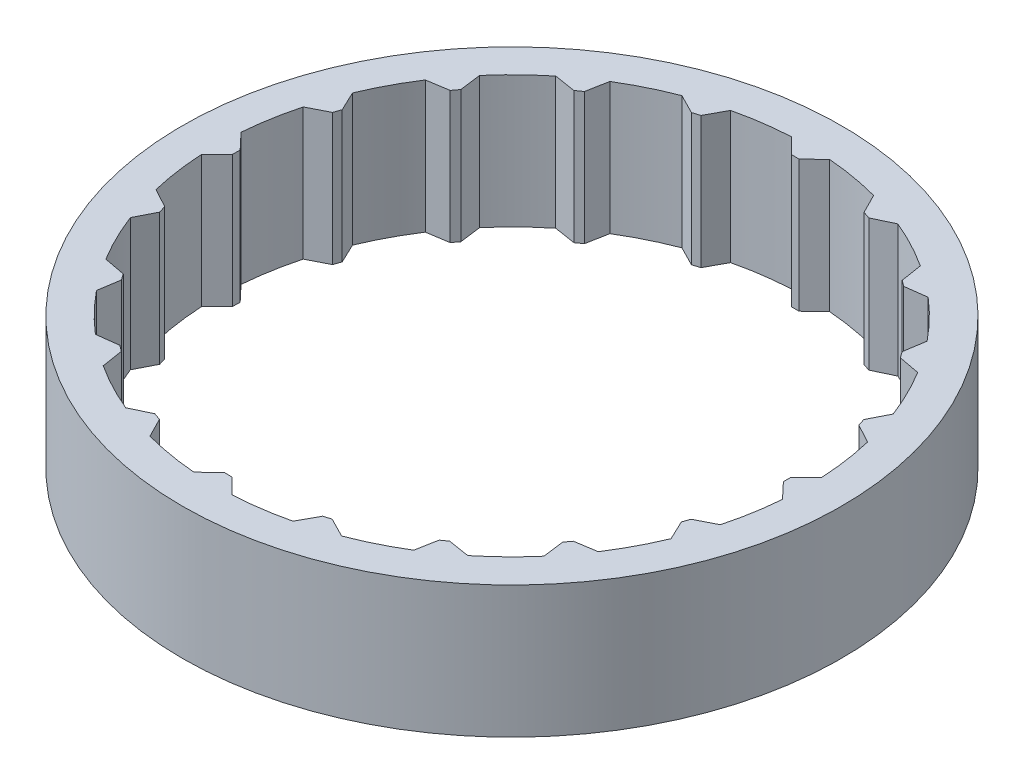
from build123d import *

# Parameters (mm, degrees)
SKETCH1_R           = 62.5
BOSS_EXTRUDE1_DEPTH = 25
CAVITY1_DEPTH       = 25
CUT_EXTRUDE1_DEPTH  = 25


# Read off the part's stored shape, not the designer's step: Cavity1
with BuildPart() as part:
    # Sketch1 → Boss-Extrude1 (new body)
    with BuildSketch(Plane(origin=(0, 0, 0), x_dir=(1, 0, 0), z_dir=(0, 1, 0))):
        with Locations(Location((0, 0, 0), (0, 0, 270))):
            Circle(SKETCH1_R)
    extrude(amount=BOSS_EXTRUDE1_DEPTH)

    # Cavity1 outline → Cavity1 (cut)
    with BuildSketch(Plane(origin=(0, 0, 0), x_dir=(1, 0, 0), z_dir=(0, 1, 0))):
        with BuildLine():
            Line((16.350867892, -49.873660473), (20.022970331, -51.745036944))
            ThreePointArc((20.022970331, -51.745036944), (24.456878574, -49.800038203), (28.704396647, -47.476000203))
            Line((28.704396647, -47.476000203), (29.464309883, -43.425207924))
            ThreePointArc((29.464309883, -43.425207924), (30.217762384, -42.903777412), (30.961999914, -42.369276757))
            Line((30.961999914, -42.369276757), (35.032663999, -43.014319485))
            ThreePointArc((35.032663999, -43.014319485), (38.648523661, -39.79436276), (41.969986165, -36.271516008))
            Line((41.969986165, -36.271516008), (41.440942946, -32.18415751))
            ThreePointArc((41.440942946, -32.18415751), (41.996387967, -31.455417996), (42.539030133, -30.717095621))
            Line((42.539030133, -30.717095621), (46.609790903, -30.07266333))
            ThreePointArc((46.609790903, -30.07266333), (49.053656447, -25.89294042), (51.12393549, -21.5161257))
            Line((51.12393549, -21.5161257), (49.357722251, -17.792300112))
            ThreePointArc((49.357722251, -17.792300112), (49.660788964, -16.927585698), (49.94871817, -16.05771374))
            Line((49.94871817, -16.05771374), (53.621101197, -14.186887953))
            ThreePointArc((53.621101197, -14.186887953), (54.653750036, -9.456539258), (55.270192281, -4.654189691))
            Line((55.270192281, -4.654189691), (52.43969828, -1.658411006))
            ThreePointArc((52.43969828, -1.658411006), (52.460720403, -0.742365963), (52.465752134, 0.173906448))
            Line((52.465752134, 0.173906448), (55.380278979, 3.087996269))
            ThreePointArc((55.380278979, 3.087996269), (54.900628251, 7.905931261), (54.002892036, 12.66372824))
            Line((54.002892036, 12.66372824), (50.385185747, 14.63821233))
            ThreePointArc((50.385185747, 14.63821233), (50.122105488, 15.515919131), (49.843747202, 16.388900869))
            Line((49.843747202, 16.388900869), (51.715123672, 20.061003308))
            ThreePointArc((51.715123672, 20.061003308), (49.770124931, 24.49491155), (47.446086932, 28.742429624))
            Line((47.446086932, 28.742429624), (43.395294653, 29.50234286))
            ThreePointArc((43.395294653, 29.50234286), (42.87386414, 30.255795361), (42.339363485, 31.000032891))
            Line((42.339363485, 31.000032891), (42.984406214, 35.070696976))
            ThreePointArc((42.984406214, 35.070696976), (39.764449489, 38.686556638), (36.241602736, 42.008019142))
            Line((36.241602736, 42.008019142), (32.154244239, 41.478975923))
            ThreePointArc((32.154244239, 41.478975923), (31.425504725, 42.034420944), (30.68718235, 42.57706311))
            Line((30.68718235, 42.57706311), (30.042750059, 46.64782388))
            ThreePointArc((30.042750059, 46.64782388), (25.863027148, 49.091689424), (21.486212429, 51.161968467))
            Line((21.486212429, 51.161968467), (17.762386841, 49.395755228))
            ThreePointArc((17.762386841, 49.395755228), (16.897672427, 49.698821941), (16.027800469, 49.986751147))
            Line((16.027800469, 49.986751147), (14.156974682, 53.659134174))
            ThreePointArc((14.156974682, 53.659134174), (9.426625987, 54.691783013), (4.62427642, 55.308225258))
            Line((4.62427642, 55.308225258), (1.628497735, 52.477731257))
            ThreePointArc((1.628497735, 52.477731257), (0.712452692, 52.49875338), (-0.20381972, 52.503785111))
            Line((-0.20381972, 52.503785111), (-3.11790954, 55.418311956))
            ThreePointArc((-3.11790954, 55.418311956), (-7.935844532, 54.938661228), (-12.693641511, 54.040925013))
            Line((-12.693641511, 54.040925013), (-14.668125602, 50.423218724))
            ThreePointArc((-14.668125602, 50.423218724), (-15.545832402, 50.160138465), (-16.41881414, 49.881780179))
            Line((-16.41881414, 49.881780179), (-20.090916579, 51.753156649))
            ThreePointArc((-20.090916579, 51.753156649), (-24.524824822, 49.808157908), (-28.772342895, 47.484119909))
            Line((-28.772342895, 47.484119909), (-29.532256132, 43.43332763))
            ThreePointArc((-29.532256132, 43.43332763), (-30.285708633, 42.911897117), (-31.029946162, 42.377396462))
            Line((-31.029946162, 42.377396462), (-35.100610248, 43.022439191))
            ThreePointArc((-35.100610248, 43.022439191), (-38.71646991, 39.802482465), (-42.037932414, 36.279635713))
            Line((-42.037932414, 36.279635713), (-41.508889194, 32.192277216))
            ThreePointArc((-41.508889194, 32.192277216), (-42.064334215, 31.463537702), (-42.606976382, 30.725215327))
            Line((-42.606976382, 30.725215327), (-46.677737151, 30.080783036))
            ThreePointArc((-46.677737151, 30.080783036), (-49.121602695, 25.901060125), (-51.191881738, 21.524245406))
            Line((-51.191881738, 21.524245406), (-49.425668499, 17.800419818))
            ThreePointArc((-49.425668499, 17.800419818), (-49.728735212, 16.935705404), (-50.016664419, 16.065833446))
            Line((-50.016664419, 16.065833446), (-53.689047445, 14.195007659))
            ThreePointArc((-53.689047445, 14.195007659), (-54.721696284, 9.464658964), (-55.33813853, 4.662309397))
            Line((-55.33813853, 4.662309397), (-52.507644528, 1.666530712))
            ThreePointArc((-52.507644528, 1.666530712), (-52.528666651, 0.750485669), (-52.533698382, -0.165786743))
            Line((-52.533698382, -0.165786743), (-55.448225228, -3.079876563))
            ThreePointArc((-55.448225228, -3.079876563), (-54.968574499, -7.897811555), (-54.070838284, -12.655608534))
            Line((-54.070838284, -12.655608534), (-50.453131995, -14.630092625))
            ThreePointArc((-50.453131995, -14.630092625), (-50.190051736, -15.507799425), (-49.91169345, -16.380781163))
            Line((-49.91169345, -16.380781163), (-51.783069921, -20.052883602))
            ThreePointArc((-51.783069921, -20.052883602), (-49.83807118, -24.486791845), (-47.51403318, -28.734309918))
            Line((-47.51403318, -28.734309918), (-43.463240901, -29.494223155))
            ThreePointArc((-43.463240901, -29.494223155), (-42.941810389, -30.247675656), (-42.407309734, -30.991913185))
            Line((-42.407309734, -30.991913185), (-43.052352462, -35.062577271))
            ThreePointArc((-43.052352462, -35.062577271), (-39.832395737, -38.678436932), (-36.309548985, -41.999899437))
            Line((-36.309548985, -41.999899437), (-32.222190487, -41.470856217))
            ThreePointArc((-32.222190487, -41.470856217), (-31.493450973, -42.026301238), (-30.755128598, -42.568943405))
            Line((-30.755128598, -42.568943405), (-30.110696307, -46.639704174))
            ThreePointArc((-30.110696307, -46.639704174), (-25.930973397, -49.083569718), (-21.554158677, -51.153848761))
            Line((-21.554158677, -51.153848761), (-17.830333089, -49.387635522))
            ThreePointArc((-17.830333089, -49.387635522), (-16.965618675, -49.690702235), (-16.095746717, -49.978631442))
            Line((-16.095746717, -49.978631442), (-14.22492093, -53.651014468))
            ThreePointArc((-14.22492093, -53.651014468), (-9.494572235, -54.683663307), (-4.692222668, -55.300105553))
            Line((-4.692222668, -55.300105553), (-1.696443983, -52.469611551))
            ThreePointArc((-1.696443983, -52.469611551), (-0.78039894, -52.490633674), (0.135873471, -52.495665405))
            Line((0.135873471, -52.495665405), (3.049963292, -55.410192251))
            ThreePointArc((3.049963292, -55.410192251), (7.867898284, -54.930541522), (12.625695263, -54.032805307))
            Line((12.625695263, -54.032805307), (14.600179353, -50.415099018))
            ThreePointArc((14.600179353, -50.415099018), (15.477886154, -50.152018759), (16.350867892, -49.873660473))
        make_face()
    extrude(amount=CAVITY1_DEPTH, mode=Mode.SUBTRACT)

    # Sketch2 → Cut-Extrude1 (cut)
    with BuildSketch(Plane(origin=(0, 25, 0), x_dir=(1, 0, 0), z_dir=(0, 1, 0))):
        with BuildLine():
            Line((-13.025692309, 54.476210835), (-15.00760521, 50.844893266))
            ThreePointArc((-15.00760521, 50.844893266), (-15.693564395, 50.637815404), (-16.376661363, 50.421482845))
            Line((-16.376661363, 50.421482845), (-20.062579743, 52.299900193))
            ThreePointArc((-20.062579743, 52.299900193), (-24.745463125, 50.256843477), (-29.222652686, 47.795491987))
            Line((-29.222652686, 47.795491987), (-29.985425025, 43.729458982))
            ThreePointArc((-29.985425025, 43.729458982), (-30.573820399, 43.320543187), (-31.156633785, 42.903710124))
            Line((-31.156633785, 42.903710124), (-35.242613361, 43.551179765))
            ThreePointArc((-35.242613361, 43.551179765), (-39.064960871, 40.161026813), (-42.562421739, 36.436614779))
            Line((-42.562421739, 36.436614779), (-42.031388044, 32.333877979))
            ThreePointArc((-42.031388044, 32.333877979), (-42.464623369, 31.763151777), (-42.890103336, 31.186620736))
            Line((-42.890103336, 31.186620736), (-46.976179961, 30.539763829))
            ThreePointArc((-46.976179961, 30.539763829), (-49.563833592, 26.134366434), (-51.739209928, 21.511465254))
            Line((-51.739209928, 21.511465254), (-49.966351477, 17.773629122))
            ThreePointArc((-49.966351477, 17.773629122), (-50.20201866, 17.096959171), (-50.428516267, 16.417165027))
            Line((-50.428516267, 16.417165027), (-54.114716289, 14.539300433))
            ThreePointArc((-54.114716289, 14.539300433), (-55.214378475, 9.549889586), (-55.854729287, 4.481021038))
            Line((-55.854729287, 4.481021038), (-53.013585818, 1.473971017))
            ThreePointArc((-53.013585818, 1.473971017), (-53.028616113, 0.757594486), (-53.033960195, 0.041080226))
            Line((-53.033960195, 0.041080226), (-55.959452674, -2.883973584))
            ThreePointArc((-55.959452674, -2.883973584), (-55.463480818, -7.968999586), (-54.506124106, -12.987659332))
            Line((-54.506124106, -12.987659332), (-50.874806537, -14.969572233))
            ThreePointArc((-50.874806537, -14.969572233), (-50.667728675, -15.655531418), (-50.451396116, -16.338628386))
            Line((-50.451396116, -16.338628386), (-52.329813465, -20.024546766))
            ThreePointArc((-52.329813465, -20.024546766), (-50.286756748, -24.707430148), (-47.825405258, -29.184619709))
            Line((-47.825405258, -29.184619709), (-43.759372253, -29.947392048))
            ThreePointArc((-43.759372253, -29.947392048), (-43.350456458, -30.535787422), (-42.933623395, -31.118600808))
            Line((-42.933623395, -31.118600808), (-43.581093036, -35.204580384))
            ThreePointArc((-43.581093036, -35.204580384), (-40.190940085, -39.026927894), (-36.46652805, -42.524388762))
            Line((-36.46652805, -42.524388762), (-32.36379125, -41.993355067))
            ThreePointArc((-32.36379125, -41.993355067), (-31.793065048, -42.426590392), (-31.216534007, -42.852070359))
            Line((-31.216534007, -42.852070359), (-30.5696771, -46.938146984))
            ThreePointArc((-30.5696771, -46.938146984), (-26.164279705, -49.525800615), (-21.541378525, -51.701176951))
            Line((-21.541378525, -51.701176951), (-17.803542393, -49.9283185))
            ThreePointArc((-17.803542393, -49.9283185), (-17.126872442, -50.163985683), (-16.447078298, -50.39048329))
            Line((-16.447078298, -50.39048329), (-14.569213704, -54.076683312))
            ThreePointArc((-14.569213704, -54.076683312), (-9.579802857, -55.176345498), (-4.510934309, -55.81669631))
            Line((-4.510934309, -55.81669631), (-1.503884289, -52.975552841))
            ThreePointArc((-1.503884289, -52.975552841), (-0.787507757, -52.990583136), (-0.070993497, -52.995927218))
            Line((-0.070993497, -52.995927218), (2.854060312, -55.921419697))
            ThreePointArc((2.854060312, -55.921419697), (7.939086314, -55.425447841), (12.957746061, -54.468091129))
            Line((12.957746061, -54.468091129), (14.939658962, -50.83677356))
            ThreePointArc((14.939658962, -50.83677356), (15.625618147, -50.629695698), (16.308715115, -50.413363139))
            Line((16.308715115, -50.413363139), (19.994633494, -52.291780488))
            ThreePointArc((19.994633494, -52.291780488), (24.677516877, -50.248723771), (29.154706438, -47.787372281))
            Line((29.154706438, -47.787372281), (29.917478777, -43.721339276))
            ThreePointArc((29.917478777, -43.721339276), (30.505874151, -43.312423481), (31.088687537, -42.895590418))
            Line((31.088687537, -42.895590418), (35.174667113, -43.543060059))
            ThreePointArc((35.174667113, -43.543060059), (38.997014623, -40.152907108), (42.494475491, -36.428495073))
            Line((42.494475491, -36.428495073), (41.963441796, -32.325758273))
            ThreePointArc((41.963441796, -32.325758273), (42.39667712, -31.755032071), (42.822157088, -31.17850103))
            Line((42.822157088, -31.17850103), (46.908233712, -30.531644123))
            ThreePointArc((46.908233712, -30.531644123), (49.495887344, -26.126246728), (51.671263679, -21.503345548))
            Line((51.671263679, -21.503345548), (49.898405229, -17.765509416))
            ThreePointArc((49.898405229, -17.765509416), (50.134072412, -17.088839465), (50.360570019, -16.409045321))
            Line((50.360570019, -16.409045321), (54.046770041, -14.531180727))
            ThreePointArc((54.046770041, -14.531180727), (55.146432227, -9.54176988), (55.786783038, -4.472901332))
            Line((55.786783038, -4.472901332), (52.94563957, -1.465851312))
            ThreePointArc((52.94563957, -1.465851312), (52.960669865, -0.74947478), (52.966013947, -0.03296052))
            Line((52.966013947, -0.03296052), (55.891506426, 2.892093289))
            ThreePointArc((55.891506426, 2.892093289), (55.39553457, 7.977119292), (54.438177858, 12.995779038))
            Line((54.438177858, 12.995779038), (50.806860289, 14.977691939))
            ThreePointArc((50.806860289, 14.977691939), (50.599782427, 15.663651124), (50.383449868, 16.346748092))
            Line((50.383449868, 16.346748092), (52.261867216, 20.032666471))
            ThreePointArc((52.261867216, 20.032666471), (50.2188105, 24.715549854), (47.75745901, 29.192739415))
            Line((47.75745901, 29.192739415), (43.691426005, 29.955511754))
            ThreePointArc((43.691426005, 29.955511754), (43.28251021, 30.543907128), (42.865677147, 31.126720514))
            Line((42.865677147, 31.126720514), (43.513146788, 35.21270009))
            ThreePointArc((43.513146788, 35.21270009), (40.122993836, 39.0350476), (36.398581802, 42.532508468))
            Line((36.398581802, 42.532508468), (32.295845002, 42.001474773))
            ThreePointArc((32.295845002, 42.001474773), (31.7251188, 42.434710097), (31.148587759, 42.860190065))
            Line((31.148587759, 42.860190065), (30.501730852, 46.946266689))
            ThreePointArc((30.501730852, 46.946266689), (26.096333457, 49.533920321), (21.473432277, 51.709296656))
            Line((21.473432277, 51.709296656), (17.735596145, 49.936438206))
            ThreePointArc((17.735596145, 49.936438206), (17.058926194, 50.172105389), (16.37913205, 50.398602996))
            Line((16.37913205, 50.398602996), (14.501267456, 54.084803018))
            ThreePointArc((14.501267456, 54.084803018), (9.511856609, 55.184465204), (4.442988061, 55.824816015))
            Line((4.442988061, 55.824816015), (1.43593804, 52.983672547))
            ThreePointArc((1.43593804, 52.983672547), (0.719561509, 52.998702842), (0.003047249, 53.004046924))
            Line((0.003047249, 53.004046924), (-2.922006561, 55.929539403))
            ThreePointArc((-2.922006561, 55.929539403), (-8.007032563, 55.433567547), (-13.025692309, 54.476210835))
        make_face()
    extrude(amount=-CUT_EXTRUDE1_DEPTH, mode=Mode.SUBTRACT)


solid = part.part
